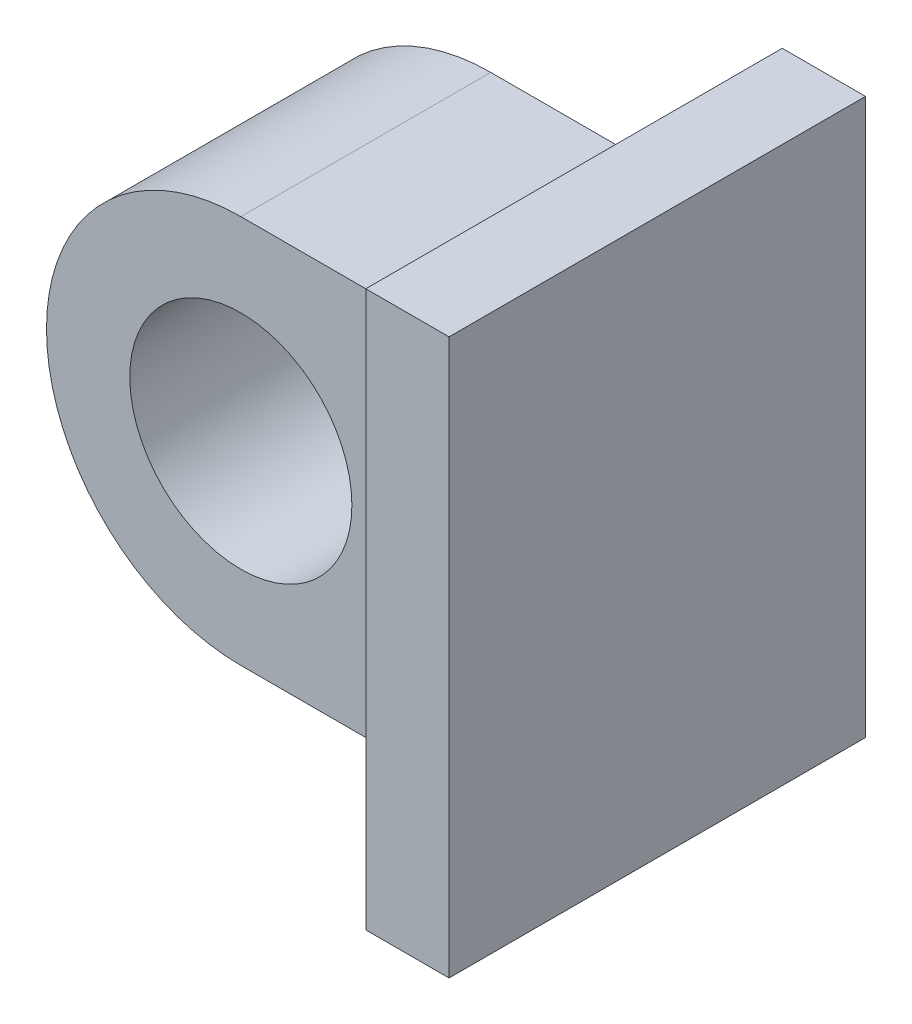
from build123d import *

# Parameters (mm, degrees)
SKETCH4_W                       = 15
SKETCH4_H                       = 20
BOSS_EXTRUDE2_DEPTH             = 3
BOSS_EXTRUDE3_REACH             = 236.985
SKETCH5_R                       = 4
BOSS_EXTRUDE3_DIRECTION_2_REACH = 236.985
CUT_EXTRUDE1_START              = -3
CUT_EXTRUDE1_DEPTH              = 3
CUT_EXTRUDE2_DEPTH              = 3


with BuildPart() as part:
    # Sketch4 → Boss-Extrude2 (new body)
    with BuildSketch(Plane(origin=(-224.130320329, 0, 0), x_dir=(0, 0, -1), z_dir=(1, 0, 0))):
        with Locations((0, 60.194598051)):
            Rectangle(SKETCH4_W, SKETCH4_H)
    extrude(amount=BOSS_EXTRUDE2_DEPTH)

    # Boss-Extrude3: up to this face of the body (flat: up to its plane)
    boss_extrude3_end = Plane(part.part.faces().sort_by_distance((-222.630320329, 60.194598051, 7.5))[0])
    # Sketch5 → Boss-Extrude3 (add, up to the picked face)
    with BuildSketch(Plane.XY, mode=Mode.PRIVATE) as boss_extrude3_sk1:
        with BuildLine():
            Line((-224.130320329, 67.194598051), (-224.130320329, 53.194598051))
            Line((-224.130320329, 53.194598051), (-231.630320329, 53.194598051))
            ThreePointArc((-231.630320329, 53.194598051), (-238.630320329, 60.194598051), (-231.630320329, 67.194598051))
            Line((-231.630320329, 67.194598051), (-224.130320329, 67.194598051))
        make_face()
        with Locations((-231.630320329, 60.194598051)):
            Circle(SKETCH5_R, mode=Mode.SUBTRACT)
    boss_extrude3_tool1 = split(extrude(boss_extrude3_sk1.sketch, amount=BOSS_EXTRUDE3_REACH, mode=Mode.PRIVATE), bisect_by=boss_extrude3_end, keep=Keep.BOTH, mode=Mode.PRIVATE)
    add(boss_extrude3_tool1.solids().sort_by(Axis((-224.331877, 60.194598, 0), (0, 0, 1)))[0])

    # Boss-Extrude3 direction 2: up to this face of the body (flat: up to its plane)
    boss_extrude3_direction_2_end = Plane(part.part.faces().sort_by_distance((-222.630320329, 60.194598051, -7.5))[0])
    # Sketch5 → Boss-Extrude3 direction 2 (add, up to the picked face)
    with BuildSketch(Plane.XY, mode=Mode.PRIVATE) as boss_extrude3_direction_2_sk1:
        with BuildLine():
            Line((-224.130320329, 67.194598051), (-224.130320329, 53.194598051))
            Line((-224.130320329, 53.194598051), (-231.630320329, 53.194598051))
            ThreePointArc((-231.630320329, 53.194598051), (-238.630320329, 60.194598051), (-231.630320329, 67.194598051))
            Line((-231.630320329, 67.194598051), (-224.130320329, 67.194598051))
        make_face()
        with Locations((-231.630320329, 60.194598051)):
            Circle(SKETCH5_R, mode=Mode.SUBTRACT)
    boss_extrude3_direction_2_tool1 = split(extrude(boss_extrude3_direction_2_sk1.sketch, amount=-BOSS_EXTRUDE3_DIRECTION_2_REACH, mode=Mode.PRIVATE), bisect_by=boss_extrude3_direction_2_end, keep=Keep.BOTH, mode=Mode.PRIVATE)
    add(boss_extrude3_direction_2_tool1.solids().sort_by(Axis((-224.331877, 60.194598, 0), (0, 0, -1)))[0])

    # Sketch6 → Cut-Extrude1 (cut)
    with BuildSketch(Plane.XY.offset(7.5).offset(CUT_EXTRUDE1_START)):
        with BuildLine():
            Line((-224.130320329, 67.194598051), (-231.630320329, 67.194598051))
            ThreePointArc((-231.630320329, 67.194598051), (-238.630320329, 60.194598051), (-231.630320329, 53.194598051))
            Line((-231.630320329, 53.194598051), (-224.130320329, 53.194598051))
            Line((-224.130320329, 53.194598051), (-224.130320329, 67.194598051))
        make_face()
    extrude(amount=CUT_EXTRUDE1_DEPTH, mode=Mode.SUBTRACT)

    # Sketch7 → Cut-Extrude2 (cut)
    with BuildSketch(Plane(origin=(0, 0, -7.5), x_dir=(-1, 0, 0), z_dir=(0, 0, -1))):
        with BuildLine():
            Line((224.130320329, 67.194598051), (231.630320329, 67.194598051))
            ThreePointArc((231.630320329, 67.194598051), (238.630320329, 60.194598051), (231.630320329, 53.194598051))
            Line((231.630320329, 53.194598051), (224.130320329, 53.194598051))
            Line((224.130320329, 53.194598051), (224.130320329, 67.194598051))
        make_face()
    extrude(amount=-CUT_EXTRUDE2_DEPTH, mode=Mode.SUBTRACT)


solid = part.part
